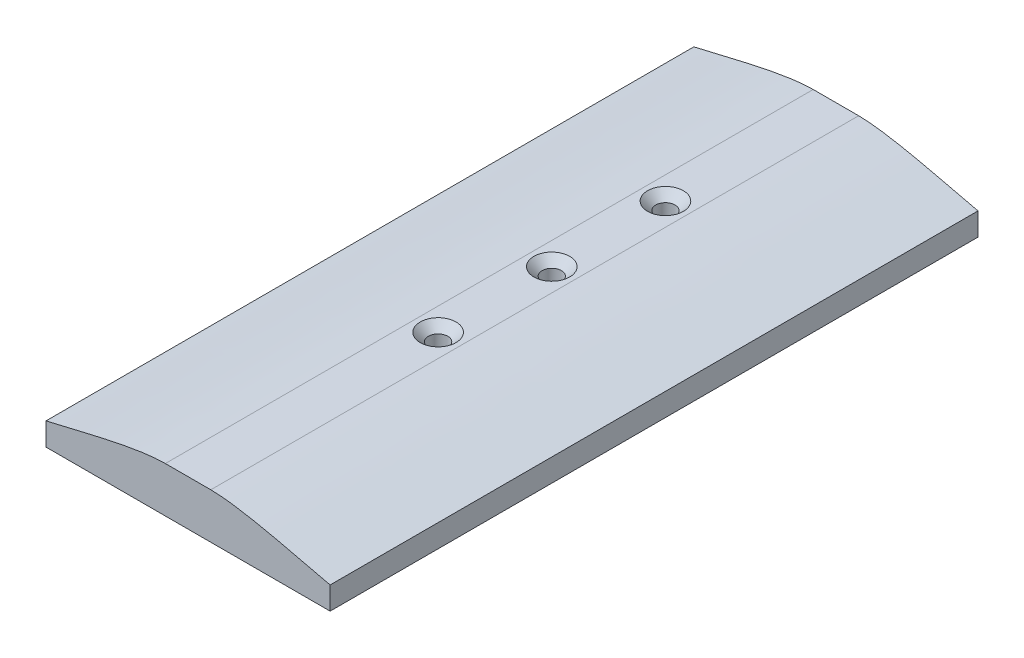
from build123d import *

# Parameters (mm, degrees)
SKETCH1_R                                       = 1.25
BOSS_EXTRUDE1_DEPTH                             = 4
BOSS_EXTRUDE2_DEPTH                             = 70
SKETCH3_R                                       = 1.6
SKETCH3_R_2                                     = 1.625
CUT_EXTRUDE1_DEPTH                              = 70
CSK_FOR_M3_FLAT_HEAD_MACHINE_SCREW1_D           = 3.4
CSK_FOR_M3_FLAT_HEAD_MACHINE_SCREW1_CSINK_D     = 6.3
CSK_FOR_M3_FLAT_HEAD_MACHINE_SCREW1_CSINK_ANGLE = 90
BOSS_EXTRUDE3_DEPTH                             = 20
BOSS_EXTRUDE4_DEPTH                             = 24


with BuildPart() as part:
    # Sketch1 → Boss-Extrude1 (new body)
    with BuildSketch(Plane(origin=(0, 0, 0), x_dir=(1, 0, 0), z_dir=(0, 1, 0))):
        Polygon((0, 35), (25, 35), (25, -35), (0, -35), (-25, -35), (-25, 35), align=None)
        with Locations((0, 25)):
            Circle(SKETCH1_R, mode=Mode.SUBTRACT)
        with Locations((0, 5)):
            Circle(SKETCH1_R, mode=Mode.SUBTRACT)
        with Locations((0, -15)):
            Circle(SKETCH1_R, mode=Mode.SUBTRACT)
    extrude(amount=BOSS_EXTRUDE1_DEPTH)

    # Sketch2 → Boss-Extrude2 (add)
    with BuildSketch(Plane(origin=(0, 0, -35), x_dir=(-1, 0, 0), z_dir=(0, 0, -1))):
        with BuildLine():
            Line((0, 8), (-4, 8))
            add(Edge.make_bspline(
                [(-4, 8), (-9.652249971, 8), (-20.325539747, 4.994261421), (-25, 4)],
                knots=[0, 0, 0, 0, 1, 1, 1, 1], degree=3))
            Line((-25, 4), (25, 4))
            add(Edge.make_bspline(
                [(4, 8), (9.652249971, 8), (20.325539747, 4.994261421), (25, 4)],
                knots=[0, 0, 0, 0, 1, 1, 1, 1], degree=3))
            Line((4, 8), (0, 8))
        make_face()
    extrude(amount=-BOSS_EXTRUDE2_DEPTH)

    # Sketch3 → Cut-Extrude1 (cut)
    with BuildSketch(Plane(origin=(0, 8, 0), x_dir=(1, 0, 0), z_dir=(0, 1, 0))):
        with Locations((0, 25)):
            Circle(SKETCH3_R)
        with Locations((0, 5)):
            Circle(SKETCH3_R)
        with Locations((0, -15)):
            Circle(SKETCH3_R_2)
    extrude(amount=-CUT_EXTRUDE1_DEPTH, mode=Mode.SUBTRACT)

    # CSK for M3 Flat Head Machine Screw1 (through all)
    with Locations(Plane(origin=(0, 8, 0), x_dir=(1, 0, 0), z_dir=(0, 1, 0))):
        with Locations((0, 25), (0, 5), (0, -15)):
            CounterSinkHole(CSK_FOR_M3_FLAT_HEAD_MACHINE_SCREW1_D / 2, CSK_FOR_M3_FLAT_HEAD_MACHINE_SCREW1_CSINK_D / 2, counter_sink_angle=CSK_FOR_M3_FLAT_HEAD_MACHINE_SCREW1_CSINK_ANGLE)

    # Sketch6 → Boss-Extrude3 (add)
    with BuildSketch(Plane(origin=(0, 0, -35), x_dir=(-1, 0, 0), z_dir=(0, 0, -1))):
        with BuildLine():
            Line((-25, 0), (25, 0))
            Line((25, 0), (25, 4))
            add(Edge.make_bspline(
                [(25, 4), (20.325539747, 4.994261421), (9.652249971, 8), (4, 8)],
                knots=[0, 0, 0, 0, 1, 1, 1, 1], degree=3))
            Line((4, 8), (-4, 8))
            add(Edge.make_bspline(
                [(-4, 8), (-9.652249971, 8), (-20.325539747, 4.994261421), (-25, 4)],
                knots=[0, 0, 0, 0, 1, 1, 1, 1], degree=3))
            Line((-25, 4), (-25, 0))
        make_face()
    extrude(amount=BOSS_EXTRUDE3_DEPTH)

    # Sketch7 → Boss-Extrude4 (add)
    with BuildSketch(Plane.XY.offset(35)):
        with BuildLine():
            Line((-25, 0), (25, 0))
            Line((25, 0), (25, 4))
            add(Edge.make_bspline(
                [(25, 4), (20.325539747, 4.994261421), (9.652249971, 8), (4, 8)],
                knots=[0, 0, 0, 0, 1, 1, 1, 1], degree=3))
            Line((4, 8), (-4, 8))
            add(Edge.make_bspline(
                [(-4, 8), (-9.652249971, 8), (-20.325539747, 4.994261421), (-25, 4)],
                knots=[0, 0, 0, 0, 1, 1, 1, 1], degree=3))
            Line((-25, 4), (-25, 0))
        make_face()
    extrude(amount=BOSS_EXTRUDE4_DEPTH)


solid = part.part
